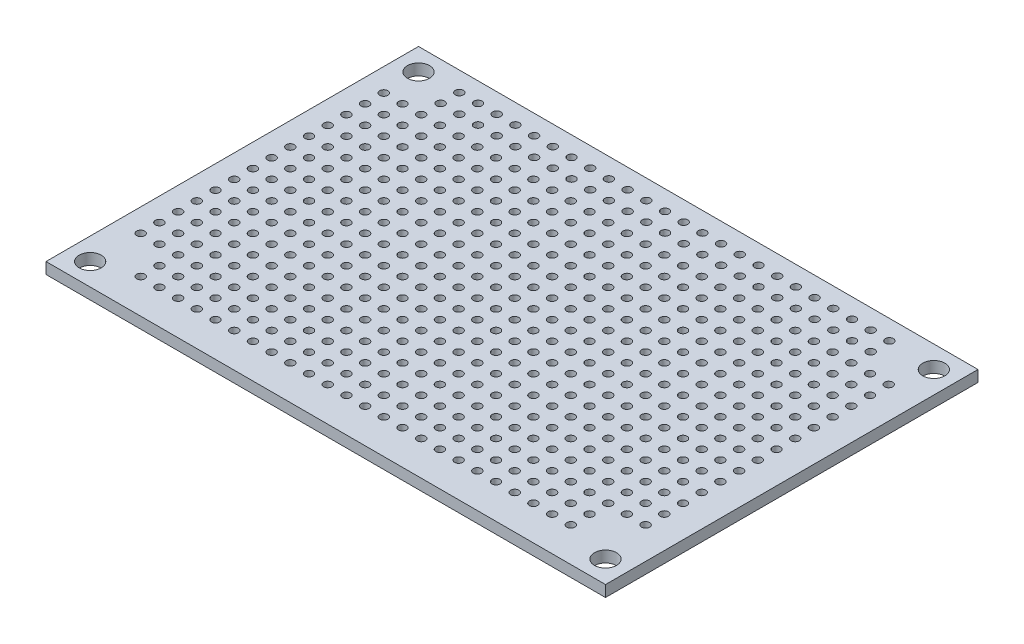
from build123d import *

# Parameters (mm, degrees)
SKETCH1_W           = 76
SKETCH1_H           = 50.6
SKETCH1_R           = 1.5
BOSS_EXTRUDE1_DEPTH = 1.53
SKETCH2_R           = 0.55
CUT_EXTRUDE1_DEPTH  = 46.677465998


with BuildPart() as part:
    # Sketch1 → Boss-Extrude1 (new body)
    with BuildSketch(Plane(origin=(0, 0, 0), x_dir=(1, 0, 0), z_dir=(0, 1, 0))):
        Rectangle(SKETCH1_W, SKETCH1_H)
        with Locations(Location((35, 22.3, 0), (0, 0, 270))):
            Circle(SKETCH1_R, mode=Mode.SUBTRACT)
        with Locations(Location((35, -22.3, 0), (0, 0, 270))):
            Circle(SKETCH1_R, mode=Mode.SUBTRACT)
        with Locations(Location((-35, -22.3, 0), (0, 0, 270))):
            Circle(SKETCH1_R, mode=Mode.SUBTRACT)
        with Locations(Location((-35, 22.3, 0), (0, 0, 270))):
            Circle(SKETCH1_R, mode=Mode.SUBTRACT)
    extrude(amount=BOSS_EXTRUDE1_DEPTH)

    # Sketch2 → Cut-Extrude1 (cut, through all)
    with BuildSketch(Plane(origin=(0, 1.53, 0), x_dir=(1, 0, 0), z_dir=(0, 1, 0))):
        with Locations(Location((-34.879245088, 17.46658145, 0), (0, 0, 270))):
            Circle(SKETCH2_R)
        with Locations(Location((-32.339245088, 17.46658145, 0), (0, 0, 270))):
            Circle(SKETCH2_R)
        with Locations(Location((-29.799245088, 17.46658145, 0), (0, 0, 270))):
            Circle(SKETCH2_R)
        with Locations(Location((-27.259245088, 17.46658145, 0), (0, 0, 270))):
            Circle(SKETCH2_R)
        with Locations(Location((-24.719245088, 17.46658145, 0), (0, 0, 270))):
            Circle(SKETCH2_R)
        with Locations(Location((-22.179245088, 17.46658145, 0), (0, 0, 270))):
            Circle(SKETCH2_R)
        with Locations(Location((-19.639245088, 17.46658145, 0), (0, 0, 270))):
            Circle(SKETCH2_R)
        with Locations(Location((-17.099245088, 17.46658145, 0), (0, 0, 270))):
            Circle(SKETCH2_R)
        with Locations(Location((-14.559245088, 17.46658145, 0), (0, 0, 270))):
            Circle(SKETCH2_R)
        with Locations(Location((-12.019245088, 17.46658145, 0), (0, 0, 270))):
            Circle(SKETCH2_R)
        with Locations(Location((-9.479245088, 17.46658145, 0), (0, 0, 270))):
            Circle(SKETCH2_R)
        with Locations(Location((-6.939245088, 17.46658145, 0), (0, 0, 270))):
            Circle(SKETCH2_R)
        with Locations(Location((-4.399245088, 17.46658145, 0), (0, 0, 270))):
            Circle(SKETCH2_R)
        with Locations(Location((-1.859245088, 17.46658145, 0), (0, 0, 270))):
            Circle(SKETCH2_R)
        with Locations(Location((0.680754912, 17.46658145, 0), (0, 0, 270))):
            Circle(SKETCH2_R)
        with Locations(Location((3.220754912, 17.46658145, 0), (0, 0, 270))):
            Circle(SKETCH2_R)
        with Locations(Location((5.760754912, 17.46658145, 0), (0, 0, 270))):
            Circle(SKETCH2_R)
        with Locations(Location((8.300754912, 17.46658145, 0), (0, 0, 270))):
            Circle(SKETCH2_R)
        with Locations(Location((10.840754912, 17.46658145, 0), (0, 0, 270))):
            Circle(SKETCH2_R)
        with Locations(Location((13.380754912, 17.46658145, 0), (0, 0, 270))):
            Circle(SKETCH2_R)
        with Locations(Location((15.920754912, 17.46658145, 0), (0, 0, 270))):
            Circle(SKETCH2_R)
        with Locations(Location((18.460754912, 17.46658145, 0), (0, 0, 270))):
            Circle(SKETCH2_R)
        with Locations(Location((21.000754912, 17.46658145, 0), (0, 0, 270))):
            Circle(SKETCH2_R)
        with Locations(Location((23.540754912, 17.46658145, 0), (0, 0, 270))):
            Circle(SKETCH2_R)
        with Locations(Location((26.080754912, 17.46658145, 0), (0, 0, 270))):
            Circle(SKETCH2_R)
        with Locations(Location((28.620754912, 17.46658145, 0), (0, 0, 270))):
            Circle(SKETCH2_R)
        with Locations(Location((31.160754912, 17.46658145, 0), (0, 0, 270))):
            Circle(SKETCH2_R)
        with Locations(Location((33.700754912, 17.46658145, 0), (0, 0, 270))):
            Circle(SKETCH2_R)
        with Locations(Location((-32.339245088, 14.92658145, 0), (0, 0, 270))):
            Circle(SKETCH2_R)
        with Locations(Location((-29.799245088, 14.92658145, 0), (0, 0, 270))):
            Circle(SKETCH2_R)
        with Locations(Location((-27.259245088, 14.92658145, 0), (0, 0, 270))):
            Circle(SKETCH2_R)
        with Locations(Location((-24.719245088, 14.92658145, 0), (0, 0, 270))):
            Circle(SKETCH2_R)
        with Locations(Location((-22.179245088, 14.92658145, 0), (0, 0, 270))):
            Circle(SKETCH2_R)
        with Locations(Location((-19.639245088, 14.92658145, 0), (0, 0, 270))):
            Circle(SKETCH2_R)
        with Locations(Location((-17.099245088, 14.92658145, 0), (0, 0, 270))):
            Circle(SKETCH2_R)
        with Locations(Location((-14.559245088, 14.92658145, 0), (0, 0, 270))):
            Circle(SKETCH2_R)
        with Locations(Location((-12.019245088, 14.92658145, 0), (0, 0, 270))):
            Circle(SKETCH2_R)
        with Locations(Location((-9.479245088, 14.92658145, 0), (0, 0, 270))):
            Circle(SKETCH2_R)
        with Locations(Location((-6.939245088, 14.92658145, 0), (0, 0, 270))):
            Circle(SKETCH2_R)
        with Locations(Location((-4.399245088, 14.92658145, 0), (0, 0, 270))):
            Circle(SKETCH2_R)
        with Locations(Location((-1.859245088, 14.92658145, 0), (0, 0, 270))):
            Circle(SKETCH2_R)
        with Locations(Location((0.680754912, 14.92658145, 0), (0, 0, 270))):
            Circle(SKETCH2_R)
        with Locations(Location((3.220754912, 14.92658145, 0), (0, 0, 270))):
            Circle(SKETCH2_R)
        with Locations(Location((5.760754912, 14.92658145, 0), (0, 0, 270))):
            Circle(SKETCH2_R)
        with Locations(Location((8.300754912, 14.92658145, 0), (0, 0, 270))):
            Circle(SKETCH2_R)
        with Locations(Location((10.840754912, 14.92658145, 0), (0, 0, 270))):
            Circle(SKETCH2_R)
        with Locations(Location((13.380754912, 14.92658145, 0), (0, 0, 270))):
            Circle(SKETCH2_R)
        with Locations(Location((15.920754912, 14.92658145, 0), (0, 0, 270))):
            Circle(SKETCH2_R)
        with Locations(Location((18.460754912, 14.92658145, 0), (0, 0, 270))):
            Circle(SKETCH2_R)
        with Locations(Location((21.000754912, 14.92658145, 0), (0, 0, 270))):
            Circle(SKETCH2_R)
        with Locations(Location((23.540754912, 14.92658145, 0), (0, 0, 270))):
            Circle(SKETCH2_R)
        with Locations(Location((26.080754912, 14.92658145, 0), (0, 0, 270))):
            Circle(SKETCH2_R)
        with Locations(Location((28.620754912, 14.92658145, 0), (0, 0, 270))):
            Circle(SKETCH2_R)
        with Locations(Location((31.160754912, 14.92658145, 0), (0, 0, 270))):
            Circle(SKETCH2_R)
        with Locations(Location((33.700754912, 14.92658145, 0), (0, 0, 270))):
            Circle(SKETCH2_R)
        with Locations(Location((-32.339245088, 12.38658145, 0), (0, 0, 270))):
            Circle(SKETCH2_R)
        with Locations(Location((-29.799245088, 12.38658145, 0), (0, 0, 270))):
            Circle(SKETCH2_R)
        with Locations(Location((-27.259245088, 12.38658145, 0), (0, 0, 270))):
            Circle(SKETCH2_R)
        with Locations(Location((-24.719245088, 12.38658145, 0), (0, 0, 270))):
            Circle(SKETCH2_R)
        with Locations(Location((-22.179245088, 12.38658145, 0), (0, 0, 270))):
            Circle(SKETCH2_R)
        with Locations(Location((-19.639245088, 12.38658145, 0), (0, 0, 270))):
            Circle(SKETCH2_R)
        with Locations(Location((-17.099245088, 12.38658145, 0), (0, 0, 270))):
            Circle(SKETCH2_R)
        with Locations(Location((-14.559245088, 12.38658145, 0), (0, 0, 270))):
            Circle(SKETCH2_R)
        with Locations(Location((-12.019245088, 12.38658145, 0), (0, 0, 270))):
            Circle(SKETCH2_R)
        with Locations(Location((-9.479245088, 12.38658145, 0), (0, 0, 270))):
            Circle(SKETCH2_R)
        with Locations(Location((-6.939245088, 12.38658145, 0), (0, 0, 270))):
            Circle(SKETCH2_R)
        with Locations(Location((-4.399245088, 12.38658145, 0), (0, 0, 270))):
            Circle(SKETCH2_R)
        with Locations(Location((-1.859245088, 12.38658145, 0), (0, 0, 270))):
            Circle(SKETCH2_R)
        with Locations(Location((0.680754912, 12.38658145, 0), (0, 0, 270))):
            Circle(SKETCH2_R)
        with Locations(Location((3.220754912, 12.38658145, 0), (0, 0, 270))):
            Circle(SKETCH2_R)
        with Locations(Location((5.760754912, 12.38658145, 0), (0, 0, 270))):
            Circle(SKETCH2_R)
        with Locations(Location((8.300754912, 12.38658145, 0), (0, 0, 270))):
            Circle(SKETCH2_R)
        with Locations(Location((10.840754912, 12.38658145, 0), (0, 0, 270))):
            Circle(SKETCH2_R)
        with Locations(Location((13.380754912, 12.38658145, 0), (0, 0, 270))):
            Circle(SKETCH2_R)
        with Locations(Location((15.920754912, 12.38658145, 0), (0, 0, 270))):
            Circle(SKETCH2_R)
        with Locations(Location((18.460754912, 12.38658145, 0), (0, 0, 270))):
            Circle(SKETCH2_R)
        with Locations(Location((21.000754912, 12.38658145, 0), (0, 0, 270))):
            Circle(SKETCH2_R)
        with Locations(Location((23.540754912, 12.38658145, 0), (0, 0, 270))):
            Circle(SKETCH2_R)
        with Locations(Location((26.080754912, 12.38658145, 0), (0, 0, 270))):
            Circle(SKETCH2_R)
        with Locations(Location((28.620754912, 12.38658145, 0), (0, 0, 270))):
            Circle(SKETCH2_R)
        with Locations(Location((31.160754912, 12.38658145, 0), (0, 0, 270))):
            Circle(SKETCH2_R)
        with Locations(Location((33.700754912, 12.38658145, 0), (0, 0, 270))):
            Circle(SKETCH2_R)
        with Locations(Location((-32.339245088, 9.84658145, 0), (0, 0, 270))):
            Circle(SKETCH2_R)
        with Locations(Location((-29.799245088, 9.84658145, 0), (0, 0, 270))):
            Circle(SKETCH2_R)
        with Locations(Location((-27.259245088, 9.84658145, 0), (0, 0, 270))):
            Circle(SKETCH2_R)
        with Locations(Location((-24.719245088, 9.84658145, 0), (0, 0, 270))):
            Circle(SKETCH2_R)
        with Locations(Location((-22.179245088, 9.84658145, 0), (0, 0, 270))):
            Circle(SKETCH2_R)
        with Locations(Location((-19.639245088, 9.84658145, 0), (0, 0, 270))):
            Circle(SKETCH2_R)
        with Locations(Location((-17.099245088, 9.84658145, 0), (0, 0, 270))):
            Circle(SKETCH2_R)
        with Locations(Location((-14.559245088, 9.84658145, 0), (0, 0, 270))):
            Circle(SKETCH2_R)
        with Locations(Location((-12.019245088, 9.84658145, 0), (0, 0, 270))):
            Circle(SKETCH2_R)
        with Locations(Location((-9.479245088, 9.84658145, 0), (0, 0, 270))):
            Circle(SKETCH2_R)
        with Locations(Location((-6.939245088, 9.84658145, 0), (0, 0, 270))):
            Circle(SKETCH2_R)
        with Locations(Location((-4.399245088, 9.84658145, 0), (0, 0, 270))):
            Circle(SKETCH2_R)
        with Locations(Location((-1.859245088, 9.84658145, 0), (0, 0, 270))):
            Circle(SKETCH2_R)
        with Locations(Location((0.680754912, 9.84658145, 0), (0, 0, 270))):
            Circle(SKETCH2_R)
        with Locations(Location((3.220754912, 9.84658145, 0), (0, 0, 270))):
            Circle(SKETCH2_R)
        with Locations(Location((5.760754912, 9.84658145, 0), (0, 0, 270))):
            Circle(SKETCH2_R)
        with Locations(Location((8.300754912, 9.84658145, 0), (0, 0, 270))):
            Circle(SKETCH2_R)
        with Locations(Location((10.840754912, 9.84658145, 0), (0, 0, 270))):
            Circle(SKETCH2_R)
        with Locations(Location((13.380754912, 9.84658145, 0), (0, 0, 270))):
            Circle(SKETCH2_R)
        with Locations(Location((15.920754912, 9.84658145, 0), (0, 0, 270))):
            Circle(SKETCH2_R)
        with Locations(Location((18.460754912, 9.84658145, 0), (0, 0, 270))):
            Circle(SKETCH2_R)
        with Locations(Location((21.000754912, 9.84658145, 0), (0, 0, 270))):
            Circle(SKETCH2_R)
        with Locations(Location((23.540754912, 9.84658145, 0), (0, 0, 270))):
            Circle(SKETCH2_R)
        with Locations(Location((26.080754912, 9.84658145, 0), (0, 0, 270))):
            Circle(SKETCH2_R)
        with Locations(Location((28.620754912, 9.84658145, 0), (0, 0, 270))):
            Circle(SKETCH2_R)
        with Locations(Location((31.160754912, 9.84658145, 0), (0, 0, 270))):
            Circle(SKETCH2_R)
        with Locations(Location((33.700754912, 9.84658145, 0), (0, 0, 270))):
            Circle(SKETCH2_R)
        with Locations(Location((-32.339245088, 7.30658145, 0), (0, 0, 270))):
            Circle(SKETCH2_R)
        with Locations(Location((-29.799245088, 7.30658145, 0), (0, 0, 270))):
            Circle(SKETCH2_R)
        with Locations(Location((-27.259245088, 7.30658145, 0), (0, 0, 270))):
            Circle(SKETCH2_R)
        with Locations(Location((-24.719245088, 7.30658145, 0), (0, 0, 270))):
            Circle(SKETCH2_R)
        with Locations(Location((-22.179245088, 7.30658145, 0), (0, 0, 270))):
            Circle(SKETCH2_R)
        with Locations(Location((-19.639245088, 7.30658145, 0), (0, 0, 270))):
            Circle(SKETCH2_R)
        with Locations(Location((-17.099245088, 7.30658145, 0), (0, 0, 270))):
            Circle(SKETCH2_R)
        with Locations(Location((-14.559245088, 7.30658145, 0), (0, 0, 270))):
            Circle(SKETCH2_R)
        with Locations(Location((-12.019245088, 7.30658145, 0), (0, 0, 270))):
            Circle(SKETCH2_R)
        with Locations(Location((-9.479245088, 7.30658145, 0), (0, 0, 270))):
            Circle(SKETCH2_R)
        with Locations(Location((-6.939245088, 7.30658145, 0), (0, 0, 270))):
            Circle(SKETCH2_R)
        with Locations(Location((-4.399245088, 7.30658145, 0), (0, 0, 270))):
            Circle(SKETCH2_R)
        with Locations(Location((-1.859245088, 7.30658145, 0), (0, 0, 270))):
            Circle(SKETCH2_R)
        with Locations(Location((0.680754912, 7.30658145, 0), (0, 0, 270))):
            Circle(SKETCH2_R)
        with Locations(Location((3.220754912, 7.30658145, 0), (0, 0, 270))):
            Circle(SKETCH2_R)
        with Locations(Location((5.760754912, 7.30658145, 0), (0, 0, 270))):
            Circle(SKETCH2_R)
        with Locations(Location((8.300754912, 7.30658145, 0), (0, 0, 270))):
            Circle(SKETCH2_R)
        with Locations(Location((10.840754912, 7.30658145, 0), (0, 0, 270))):
            Circle(SKETCH2_R)
        with Locations(Location((13.380754912, 7.30658145, 0), (0, 0, 270))):
            Circle(SKETCH2_R)
        with Locations(Location((15.920754912, 7.30658145, 0), (0, 0, 270))):
            Circle(SKETCH2_R)
        with Locations(Location((18.460754912, 7.30658145, 0), (0, 0, 270))):
            Circle(SKETCH2_R)
        with Locations(Location((21.000754912, 7.30658145, 0), (0, 0, 270))):
            Circle(SKETCH2_R)
        with Locations(Location((23.540754912, 7.30658145, 0), (0, 0, 270))):
            Circle(SKETCH2_R)
        with Locations(Location((26.080754912, 7.30658145, 0), (0, 0, 270))):
            Circle(SKETCH2_R)
        with Locations(Location((28.620754912, 7.30658145, 0), (0, 0, 270))):
            Circle(SKETCH2_R)
        with Locations(Location((31.160754912, 7.30658145, 0), (0, 0, 270))):
            Circle(SKETCH2_R)
        with Locations(Location((33.700754912, 7.30658145, 0), (0, 0, 270))):
            Circle(SKETCH2_R)
        with Locations(Location((-32.339245088, 4.76658145, 0), (0, 0, 270))):
            Circle(SKETCH2_R)
        with Locations(Location((-29.799245088, 4.76658145, 0), (0, 0, 270))):
            Circle(SKETCH2_R)
        with Locations(Location((-27.259245088, 4.76658145, 0), (0, 0, 270))):
            Circle(SKETCH2_R)
        with Locations(Location((-24.719245088, 4.76658145, 0), (0, 0, 270))):
            Circle(SKETCH2_R)
        with Locations(Location((-22.179245088, 4.76658145, 0), (0, 0, 270))):
            Circle(SKETCH2_R)
        with Locations(Location((-19.639245088, 4.76658145, 0), (0, 0, 270))):
            Circle(SKETCH2_R)
        with Locations(Location((-17.099245088, 4.76658145, 0), (0, 0, 270))):
            Circle(SKETCH2_R)
        with Locations(Location((-14.559245088, 4.76658145, 0), (0, 0, 270))):
            Circle(SKETCH2_R)
        with Locations(Location((-12.019245088, 4.76658145, 0), (0, 0, 270))):
            Circle(SKETCH2_R)
        with Locations(Location((-9.479245088, 4.76658145, 0), (0, 0, 270))):
            Circle(SKETCH2_R)
        with Locations(Location((-6.939245088, 4.76658145, 0), (0, 0, 270))):
            Circle(SKETCH2_R)
        with Locations(Location((-4.399245088, 4.76658145, 0), (0, 0, 270))):
            Circle(SKETCH2_R)
        with Locations(Location((-1.859245088, 4.76658145, 0), (0, 0, 270))):
            Circle(SKETCH2_R)
        with Locations(Location((0.680754912, 4.76658145, 0), (0, 0, 270))):
            Circle(SKETCH2_R)
        with Locations(Location((3.220754912, 4.76658145, 0), (0, 0, 270))):
            Circle(SKETCH2_R)
        with Locations(Location((5.760754912, 4.76658145, 0), (0, 0, 270))):
            Circle(SKETCH2_R)
        with Locations(Location((8.300754912, 4.76658145, 0), (0, 0, 270))):
            Circle(SKETCH2_R)
        with Locations(Location((10.840754912, 4.76658145, 0), (0, 0, 270))):
            Circle(SKETCH2_R)
        with Locations(Location((13.380754912, 4.76658145, 0), (0, 0, 270))):
            Circle(SKETCH2_R)
        with Locations(Location((15.920754912, 4.76658145, 0), (0, 0, 270))):
            Circle(SKETCH2_R)
        with Locations(Location((18.460754912, 4.76658145, 0), (0, 0, 270))):
            Circle(SKETCH2_R)
        with Locations(Location((21.000754912, 4.76658145, 0), (0, 0, 270))):
            Circle(SKETCH2_R)
        with Locations(Location((23.540754912, 4.76658145, 0), (0, 0, 270))):
            Circle(SKETCH2_R)
        with Locations(Location((26.080754912, 4.76658145, 0), (0, 0, 270))):
            Circle(SKETCH2_R)
        with Locations(Location((28.620754912, 4.76658145, 0), (0, 0, 270))):
            Circle(SKETCH2_R)
        with Locations(Location((31.160754912, 4.76658145, 0), (0, 0, 270))):
            Circle(SKETCH2_R)
        with Locations(Location((33.700754912, 4.76658145, 0), (0, 0, 270))):
            Circle(SKETCH2_R)
        with Locations(Location((-32.339245088, 2.22658145, 0), (0, 0, 270))):
            Circle(SKETCH2_R)
        with Locations(Location((-29.799245088, 2.22658145, 0), (0, 0, 270))):
            Circle(SKETCH2_R)
        with Locations(Location((-27.259245088, 2.22658145, 0), (0, 0, 270))):
            Circle(SKETCH2_R)
        with Locations(Location((-24.719245088, 2.22658145, 0), (0, 0, 270))):
            Circle(SKETCH2_R)
        with Locations(Location((-22.179245088, 2.22658145, 0), (0, 0, 270))):
            Circle(SKETCH2_R)
        with Locations(Location((-19.639245088, 2.22658145, 0), (0, 0, 270))):
            Circle(SKETCH2_R)
        with Locations(Location((-17.099245088, 2.22658145, 0), (0, 0, 270))):
            Circle(SKETCH2_R)
        with Locations(Location((-14.559245088, 2.22658145, 0), (0, 0, 270))):
            Circle(SKETCH2_R)
        with Locations(Location((-12.019245088, 2.22658145, 0), (0, 0, 270))):
            Circle(SKETCH2_R)
        with Locations(Location((-9.479245088, 2.22658145, 0), (0, 0, 270))):
            Circle(SKETCH2_R)
        with Locations(Location((-6.939245088, 2.22658145, 0), (0, 0, 270))):
            Circle(SKETCH2_R)
        with Locations(Location((-4.399245088, 2.22658145, 0), (0, 0, 270))):
            Circle(SKETCH2_R)
        with Locations(Location((-1.859245088, 2.22658145, 0), (0, 0, 270))):
            Circle(SKETCH2_R)
        with Locations(Location((0.680754912, 2.22658145, 0), (0, 0, 270))):
            Circle(SKETCH2_R)
        with Locations(Location((3.220754912, 2.22658145, 0), (0, 0, 270))):
            Circle(SKETCH2_R)
        with Locations(Location((5.760754912, 2.22658145, 0), (0, 0, 270))):
            Circle(SKETCH2_R)
        with Locations(Location((8.300754912, 2.22658145, 0), (0, 0, 270))):
            Circle(SKETCH2_R)
        with Locations(Location((10.840754912, 2.22658145, 0), (0, 0, 270))):
            Circle(SKETCH2_R)
        with Locations(Location((13.380754912, 2.22658145, 0), (0, 0, 270))):
            Circle(SKETCH2_R)
        with Locations(Location((15.920754912, 2.22658145, 0), (0, 0, 270))):
            Circle(SKETCH2_R)
        with Locations(Location((18.460754912, 2.22658145, 0), (0, 0, 270))):
            Circle(SKETCH2_R)
        with Locations(Location((21.000754912, 2.22658145, 0), (0, 0, 270))):
            Circle(SKETCH2_R)
        with Locations(Location((23.540754912, 2.22658145, 0), (0, 0, 270))):
            Circle(SKETCH2_R)
        with Locations(Location((26.080754912, 2.22658145, 0), (0, 0, 270))):
            Circle(SKETCH2_R)
        with Locations(Location((28.620754912, 2.22658145, 0), (0, 0, 270))):
            Circle(SKETCH2_R)
        with Locations(Location((31.160754912, 2.22658145, 0), (0, 0, 270))):
            Circle(SKETCH2_R)
        with Locations(Location((33.700754912, 2.22658145, 0), (0, 0, 270))):
            Circle(SKETCH2_R)
        with Locations(Location((-32.339245088, -0.31341855, 0), (0, 0, 270))):
            Circle(SKETCH2_R)
        with Locations(Location((-29.799245088, -0.31341855, 0), (0, 0, 270))):
            Circle(SKETCH2_R)
        with Locations(Location((-27.259245088, -0.31341855, 0), (0, 0, 270))):
            Circle(SKETCH2_R)
        with Locations(Location((-24.719245088, -0.31341855, 0), (0, 0, 270))):
            Circle(SKETCH2_R)
        with Locations(Location((-22.179245088, -0.31341855, 0), (0, 0, 270))):
            Circle(SKETCH2_R)
        with Locations(Location((-19.639245088, -0.31341855, 0), (0, 0, 270))):
            Circle(SKETCH2_R)
        with Locations(Location((-17.099245088, -0.31341855, 0), (0, 0, 270))):
            Circle(SKETCH2_R)
        with Locations(Location((-14.559245088, -0.31341855, 0), (0, 0, 270))):
            Circle(SKETCH2_R)
        with Locations(Location((-12.019245088, -0.31341855, 0), (0, 0, 270))):
            Circle(SKETCH2_R)
        with Locations(Location((-9.479245088, -0.31341855, 0), (0, 0, 270))):
            Circle(SKETCH2_R)
        with Locations(Location((-6.939245088, -0.31341855, 0), (0, 0, 270))):
            Circle(SKETCH2_R)
        with Locations(Location((-4.399245088, -0.31341855, 0), (0, 0, 270))):
            Circle(SKETCH2_R)
        with Locations(Location((-1.859245088, -0.31341855, 0), (0, 0, 270))):
            Circle(SKETCH2_R)
        with Locations(Location((0.680754912, -0.31341855, 0), (0, 0, 270))):
            Circle(SKETCH2_R)
        with Locations(Location((3.220754912, -0.31341855, 0), (0, 0, 270))):
            Circle(SKETCH2_R)
        with Locations(Location((5.760754912, -0.31341855, 0), (0, 0, 270))):
            Circle(SKETCH2_R)
        with Locations(Location((8.300754912, -0.31341855, 0), (0, 0, 270))):
            Circle(SKETCH2_R)
        with Locations(Location((10.840754912, -0.31341855, 0), (0, 0, 270))):
            Circle(SKETCH2_R)
        with Locations(Location((13.380754912, -0.31341855, 0), (0, 0, 270))):
            Circle(SKETCH2_R)
        with Locations(Location((15.920754912, -0.31341855, 0), (0, 0, 270))):
            Circle(SKETCH2_R)
        with Locations(Location((18.460754912, -0.31341855, 0), (0, 0, 270))):
            Circle(SKETCH2_R)
        with Locations(Location((21.000754912, -0.31341855, 0), (0, 0, 270))):
            Circle(SKETCH2_R)
        with Locations(Location((23.540754912, -0.31341855, 0), (0, 0, 270))):
            Circle(SKETCH2_R)
        with Locations(Location((26.080754912, -0.31341855, 0), (0, 0, 270))):
            Circle(SKETCH2_R)
        with Locations(Location((28.620754912, -0.31341855, 0), (0, 0, 270))):
            Circle(SKETCH2_R)
        with Locations(Location((31.160754912, -0.31341855, 0), (0, 0, 270))):
            Circle(SKETCH2_R)
        with Locations(Location((33.700754912, -0.31341855, 0), (0, 0, 270))):
            Circle(SKETCH2_R)
        with Locations(Location((-32.339245088, -2.85341855, 0), (0, 0, 270))):
            Circle(SKETCH2_R)
        with Locations(Location((-29.799245088, -2.85341855, 0), (0, 0, 270))):
            Circle(SKETCH2_R)
        with Locations(Location((-27.259245088, -2.85341855, 0), (0, 0, 270))):
            Circle(SKETCH2_R)
        with Locations(Location((-24.719245088, -2.85341855, 0), (0, 0, 270))):
            Circle(SKETCH2_R)
        with Locations(Location((-22.179245088, -2.85341855, 0), (0, 0, 270))):
            Circle(SKETCH2_R)
        with Locations(Location((-19.639245088, -2.85341855, 0), (0, 0, 270))):
            Circle(SKETCH2_R)
        with Locations(Location((-17.099245088, -2.85341855, 0), (0, 0, 270))):
            Circle(SKETCH2_R)
        with Locations(Location((-14.559245088, -2.85341855, 0), (0, 0, 270))):
            Circle(SKETCH2_R)
        with Locations(Location((-12.019245088, -2.85341855, 0), (0, 0, 270))):
            Circle(SKETCH2_R)
        with Locations(Location((-9.479245088, -2.85341855, 0), (0, 0, 270))):
            Circle(SKETCH2_R)
        with Locations(Location((-6.939245088, -2.85341855, 0), (0, 0, 270))):
            Circle(SKETCH2_R)
        with Locations(Location((-4.399245088, -2.85341855, 0), (0, 0, 270))):
            Circle(SKETCH2_R)
        with Locations(Location((-1.859245088, -2.85341855, 0), (0, 0, 270))):
            Circle(SKETCH2_R)
        with Locations(Location((0.680754912, -2.85341855, 0), (0, 0, 270))):
            Circle(SKETCH2_R)
        with Locations(Location((3.220754912, -2.85341855, 0), (0, 0, 270))):
            Circle(SKETCH2_R)
        with Locations(Location((5.760754912, -2.85341855, 0), (0, 0, 270))):
            Circle(SKETCH2_R)
        with Locations(Location((8.300754912, -2.85341855, 0), (0, 0, 270))):
            Circle(SKETCH2_R)
        with Locations(Location((10.840754912, -2.85341855, 0), (0, 0, 270))):
            Circle(SKETCH2_R)
        with Locations(Location((13.380754912, -2.85341855, 0), (0, 0, 270))):
            Circle(SKETCH2_R)
        with Locations(Location((15.920754912, -2.85341855, 0), (0, 0, 270))):
            Circle(SKETCH2_R)
        with Locations(Location((18.460754912, -2.85341855, 0), (0, 0, 270))):
            Circle(SKETCH2_R)
        with Locations(Location((21.000754912, -2.85341855, 0), (0, 0, 270))):
            Circle(SKETCH2_R)
        with Locations(Location((23.540754912, -2.85341855, 0), (0, 0, 270))):
            Circle(SKETCH2_R)
        with Locations(Location((26.080754912, -2.85341855, 0), (0, 0, 270))):
            Circle(SKETCH2_R)
        with Locations(Location((28.620754912, -2.85341855, 0), (0, 0, 270))):
            Circle(SKETCH2_R)
        with Locations(Location((31.160754912, -2.85341855, 0), (0, 0, 270))):
            Circle(SKETCH2_R)
        with Locations(Location((33.700754912, -2.85341855, 0), (0, 0, 270))):
            Circle(SKETCH2_R)
        with Locations(Location((-32.339245088, -5.39341855, 0), (0, 0, 270))):
            Circle(SKETCH2_R)
        with Locations(Location((-29.799245088, -5.39341855, 0), (0, 0, 270))):
            Circle(SKETCH2_R)
        with Locations(Location((-27.259245088, -5.39341855, 0), (0, 0, 270))):
            Circle(SKETCH2_R)
        with Locations(Location((-24.719245088, -5.39341855, 0), (0, 0, 270))):
            Circle(SKETCH2_R)
        with Locations(Location((-22.179245088, -5.39341855, 0), (0, 0, 270))):
            Circle(SKETCH2_R)
        with Locations(Location((-19.639245088, -5.39341855, 0), (0, 0, 270))):
            Circle(SKETCH2_R)
        with Locations(Location((-17.099245088, -5.39341855, 0), (0, 0, 270))):
            Circle(SKETCH2_R)
        with Locations(Location((-14.559245088, -5.39341855, 0), (0, 0, 270))):
            Circle(SKETCH2_R)
        with Locations(Location((-12.019245088, -5.39341855, 0), (0, 0, 270))):
            Circle(SKETCH2_R)
        with Locations(Location((-9.479245088, -5.39341855, 0), (0, 0, 270))):
            Circle(SKETCH2_R)
        with Locations(Location((-6.939245088, -5.39341855, 0), (0, 0, 270))):
            Circle(SKETCH2_R)
        with Locations(Location((-4.399245088, -5.39341855, 0), (0, 0, 270))):
            Circle(SKETCH2_R)
        with Locations(Location((-1.859245088, -5.39341855, 0), (0, 0, 270))):
            Circle(SKETCH2_R)
        with Locations(Location((0.680754912, -5.39341855, 0), (0, 0, 270))):
            Circle(SKETCH2_R)
        with Locations(Location((3.220754912, -5.39341855, 0), (0, 0, 270))):
            Circle(SKETCH2_R)
        with Locations(Location((5.760754912, -5.39341855, 0), (0, 0, 270))):
            Circle(SKETCH2_R)
        with Locations(Location((8.300754912, -5.39341855, 0), (0, 0, 270))):
            Circle(SKETCH2_R)
        with Locations(Location((10.840754912, -5.39341855, 0), (0, 0, 270))):
            Circle(SKETCH2_R)
        with Locations(Location((13.380754912, -5.39341855, 0), (0, 0, 270))):
            Circle(SKETCH2_R)
        with Locations(Location((15.920754912, -5.39341855, 0), (0, 0, 270))):
            Circle(SKETCH2_R)
        with Locations(Location((18.460754912, -5.39341855, 0), (0, 0, 270))):
            Circle(SKETCH2_R)
        with Locations(Location((21.000754912, -5.39341855, 0), (0, 0, 270))):
            Circle(SKETCH2_R)
        with Locations(Location((23.540754912, -5.39341855, 0), (0, 0, 270))):
            Circle(SKETCH2_R)
        with Locations(Location((26.080754912, -5.39341855, 0), (0, 0, 270))):
            Circle(SKETCH2_R)
        with Locations(Location((28.620754912, -5.39341855, 0), (0, 0, 270))):
            Circle(SKETCH2_R)
        with Locations(Location((31.160754912, -5.39341855, 0), (0, 0, 270))):
            Circle(SKETCH2_R)
        with Locations(Location((33.700754912, -5.39341855, 0), (0, 0, 270))):
            Circle(SKETCH2_R)
        with Locations(Location((-32.339245088, -7.93341855, 0), (0, 0, 270))):
            Circle(SKETCH2_R)
        with Locations(Location((-29.799245088, -7.93341855, 0), (0, 0, 270))):
            Circle(SKETCH2_R)
        with Locations(Location((-27.259245088, -7.93341855, 0), (0, 0, 270))):
            Circle(SKETCH2_R)
        with Locations(Location((-24.719245088, -7.93341855, 0), (0, 0, 270))):
            Circle(SKETCH2_R)
        with Locations(Location((-22.179245088, -7.93341855, 0), (0, 0, 270))):
            Circle(SKETCH2_R)
        with Locations(Location((-19.639245088, -7.93341855, 0), (0, 0, 270))):
            Circle(SKETCH2_R)
        with Locations(Location((-17.099245088, -7.93341855, 0), (0, 0, 270))):
            Circle(SKETCH2_R)
        with Locations(Location((-14.559245088, -7.93341855, 0), (0, 0, 270))):
            Circle(SKETCH2_R)
        with Locations(Location((-12.019245088, -7.93341855, 0), (0, 0, 270))):
            Circle(SKETCH2_R)
        with Locations(Location((-9.479245088, -7.93341855, 0), (0, 0, 270))):
            Circle(SKETCH2_R)
        with Locations(Location((-6.939245088, -7.93341855, 0), (0, 0, 270))):
            Circle(SKETCH2_R)
        with Locations(Location((-4.399245088, -7.93341855, 0), (0, 0, 270))):
            Circle(SKETCH2_R)
        with Locations(Location((-1.859245088, -7.93341855, 0), (0, 0, 270))):
            Circle(SKETCH2_R)
        with Locations(Location((0.680754912, -7.93341855, 0), (0, 0, 270))):
            Circle(SKETCH2_R)
        with Locations(Location((3.220754912, -7.93341855, 0), (0, 0, 270))):
            Circle(SKETCH2_R)
        with Locations(Location((5.760754912, -7.93341855, 0), (0, 0, 270))):
            Circle(SKETCH2_R)
        with Locations(Location((8.300754912, -7.93341855, 0), (0, 0, 270))):
            Circle(SKETCH2_R)
        with Locations(Location((10.840754912, -7.93341855, 0), (0, 0, 270))):
            Circle(SKETCH2_R)
        with Locations(Location((13.380754912, -7.93341855, 0), (0, 0, 270))):
            Circle(SKETCH2_R)
        with Locations(Location((15.920754912, -7.93341855, 0), (0, 0, 270))):
            Circle(SKETCH2_R)
        with Locations(Location((18.460754912, -7.93341855, 0), (0, 0, 270))):
            Circle(SKETCH2_R)
        with Locations(Location((21.000754912, -7.93341855, 0), (0, 0, 270))):
            Circle(SKETCH2_R)
        with Locations(Location((23.540754912, -7.93341855, 0), (0, 0, 270))):
            Circle(SKETCH2_R)
        with Locations(Location((26.080754912, -7.93341855, 0), (0, 0, 270))):
            Circle(SKETCH2_R)
        with Locations(Location((28.620754912, -7.93341855, 0), (0, 0, 270))):
            Circle(SKETCH2_R)
        with Locations(Location((31.160754912, -7.93341855, 0), (0, 0, 270))):
            Circle(SKETCH2_R)
        with Locations(Location((33.700754912, -7.93341855, 0), (0, 0, 270))):
            Circle(SKETCH2_R)
        with Locations(Location((-32.339245088, -10.47341855, 0), (0, 0, 270))):
            Circle(SKETCH2_R)
        with Locations(Location((-29.799245088, -10.47341855, 0), (0, 0, 270))):
            Circle(SKETCH2_R)
        with Locations(Location((-27.259245088, -10.47341855, 0), (0, 0, 270))):
            Circle(SKETCH2_R)
        with Locations(Location((-24.719245088, -10.47341855, 0), (0, 0, 270))):
            Circle(SKETCH2_R)
        with Locations(Location((-22.179245088, -10.47341855, 0), (0, 0, 270))):
            Circle(SKETCH2_R)
        with Locations(Location((-19.639245088, -10.47341855, 0), (0, 0, 270))):
            Circle(SKETCH2_R)
        with Locations(Location((-17.099245088, -10.47341855, 0), (0, 0, 270))):
            Circle(SKETCH2_R)
        with Locations(Location((-14.559245088, -10.47341855, 0), (0, 0, 270))):
            Circle(SKETCH2_R)
        with Locations(Location((-12.019245088, -10.47341855, 0), (0, 0, 270))):
            Circle(SKETCH2_R)
        with Locations(Location((-9.479245088, -10.47341855, 0), (0, 0, 270))):
            Circle(SKETCH2_R)
        with Locations(Location((-6.939245088, -10.47341855, 0), (0, 0, 270))):
            Circle(SKETCH2_R)
        with Locations(Location((-4.399245088, -10.47341855, 0), (0, 0, 270))):
            Circle(SKETCH2_R)
        with Locations(Location((-1.859245088, -10.47341855, 0), (0, 0, 270))):
            Circle(SKETCH2_R)
        with Locations(Location((0.680754912, -10.47341855, 0), (0, 0, 270))):
            Circle(SKETCH2_R)
        with Locations(Location((3.220754912, -10.47341855, 0), (0, 0, 270))):
            Circle(SKETCH2_R)
        with Locations(Location((5.760754912, -10.47341855, 0), (0, 0, 270))):
            Circle(SKETCH2_R)
        with Locations(Location((8.300754912, -10.47341855, 0), (0, 0, 270))):
            Circle(SKETCH2_R)
        with Locations(Location((10.840754912, -10.47341855, 0), (0, 0, 270))):
            Circle(SKETCH2_R)
        with Locations(Location((13.380754912, -10.47341855, 0), (0, 0, 270))):
            Circle(SKETCH2_R)
        with Locations(Location((15.920754912, -10.47341855, 0), (0, 0, 270))):
            Circle(SKETCH2_R)
        with Locations(Location((18.460754912, -10.47341855, 0), (0, 0, 270))):
            Circle(SKETCH2_R)
        with Locations(Location((21.000754912, -10.47341855, 0), (0, 0, 270))):
            Circle(SKETCH2_R)
        with Locations(Location((23.540754912, -10.47341855, 0), (0, 0, 270))):
            Circle(SKETCH2_R)
        with Locations(Location((26.080754912, -10.47341855, 0), (0, 0, 270))):
            Circle(SKETCH2_R)
        with Locations(Location((28.620754912, -10.47341855, 0), (0, 0, 270))):
            Circle(SKETCH2_R)
        with Locations(Location((31.160754912, -10.47341855, 0), (0, 0, 270))):
            Circle(SKETCH2_R)
        with Locations(Location((33.700754912, -10.47341855, 0), (0, 0, 270))):
            Circle(SKETCH2_R)
        with Locations(Location((-32.339245088, -13.01341855, 0), (0, 0, 270))):
            Circle(SKETCH2_R)
        with Locations(Location((-29.799245088, -13.01341855, 0), (0, 0, 270))):
            Circle(SKETCH2_R)
        with Locations(Location((-27.259245088, -13.01341855, 0), (0, 0, 270))):
            Circle(SKETCH2_R)
        with Locations(Location((-24.719245088, -13.01341855, 0), (0, 0, 270))):
            Circle(SKETCH2_R)
        with Locations(Location((-22.179245088, -13.01341855, 0), (0, 0, 270))):
            Circle(SKETCH2_R)
        with Locations(Location((-19.639245088, -13.01341855, 0), (0, 0, 270))):
            Circle(SKETCH2_R)
        with Locations(Location((-17.099245088, -13.01341855, 0), (0, 0, 270))):
            Circle(SKETCH2_R)
        with Locations(Location((-14.559245088, -13.01341855, 0), (0, 0, 270))):
            Circle(SKETCH2_R)
        with Locations(Location((-12.019245088, -13.01341855, 0), (0, 0, 270))):
            Circle(SKETCH2_R)
        with Locations(Location((-9.479245088, -13.01341855, 0), (0, 0, 270))):
            Circle(SKETCH2_R)
        with Locations(Location((-6.939245088, -13.01341855, 0), (0, 0, 270))):
            Circle(SKETCH2_R)
        with Locations(Location((-4.399245088, -13.01341855, 0), (0, 0, 270))):
            Circle(SKETCH2_R)
        with Locations(Location((-1.859245088, -13.01341855, 0), (0, 0, 270))):
            Circle(SKETCH2_R)
        with Locations(Location((0.680754912, -13.01341855, 0), (0, 0, 270))):
            Circle(SKETCH2_R)
        with Locations(Location((3.220754912, -13.01341855, 0), (0, 0, 270))):
            Circle(SKETCH2_R)
        with Locations(Location((5.760754912, -13.01341855, 0), (0, 0, 270))):
            Circle(SKETCH2_R)
        with Locations(Location((8.300754912, -13.01341855, 0), (0, 0, 270))):
            Circle(SKETCH2_R)
        with Locations(Location((10.840754912, -13.01341855, 0), (0, 0, 270))):
            Circle(SKETCH2_R)
        with Locations(Location((13.380754912, -13.01341855, 0), (0, 0, 270))):
            Circle(SKETCH2_R)
        with Locations(Location((15.920754912, -13.01341855, 0), (0, 0, 270))):
            Circle(SKETCH2_R)
        with Locations(Location((18.460754912, -13.01341855, 0), (0, 0, 270))):
            Circle(SKETCH2_R)
        with Locations(Location((21.000754912, -13.01341855, 0), (0, 0, 270))):
            Circle(SKETCH2_R)
        with Locations(Location((23.540754912, -13.01341855, 0), (0, 0, 270))):
            Circle(SKETCH2_R)
        with Locations(Location((26.080754912, -13.01341855, 0), (0, 0, 270))):
            Circle(SKETCH2_R)
        with Locations(Location((28.620754912, -13.01341855, 0), (0, 0, 270))):
            Circle(SKETCH2_R)
        with Locations(Location((31.160754912, -13.01341855, 0), (0, 0, 270))):
            Circle(SKETCH2_R)
        with Locations(Location((33.700754912, -13.01341855, 0), (0, 0, 270))):
            Circle(SKETCH2_R)
        with Locations(Location((-32.339245088, -15.55341855, 0), (0, 0, 270))):
            Circle(SKETCH2_R)
        with Locations(Location((-29.799245088, -15.55341855, 0), (0, 0, 270))):
            Circle(SKETCH2_R)
        with Locations(Location((-27.259245088, -15.55341855, 0), (0, 0, 270))):
            Circle(SKETCH2_R)
        with Locations(Location((-24.719245088, -15.55341855, 0), (0, 0, 270))):
            Circle(SKETCH2_R)
        with Locations(Location((-22.179245088, -15.55341855, 0), (0, 0, 270))):
            Circle(SKETCH2_R)
        with Locations(Location((-19.639245088, -15.55341855, 0), (0, 0, 270))):
            Circle(SKETCH2_R)
        with Locations(Location((-17.099245088, -15.55341855, 0), (0, 0, 270))):
            Circle(SKETCH2_R)
        with Locations(Location((-14.559245088, -15.55341855, 0), (0, 0, 270))):
            Circle(SKETCH2_R)
        with Locations(Location((-12.019245088, -15.55341855, 0), (0, 0, 270))):
            Circle(SKETCH2_R)
        with Locations(Location((-9.479245088, -15.55341855, 0), (0, 0, 270))):
            Circle(SKETCH2_R)
        with Locations(Location((-6.939245088, -15.55341855, 0), (0, 0, 270))):
            Circle(SKETCH2_R)
        with Locations(Location((-4.399245088, -15.55341855, 0), (0, 0, 270))):
            Circle(SKETCH2_R)
        with Locations(Location((-1.859245088, -15.55341855, 0), (0, 0, 270))):
            Circle(SKETCH2_R)
        with Locations(Location((0.680754912, -15.55341855, 0), (0, 0, 270))):
            Circle(SKETCH2_R)
        with Locations(Location((3.220754912, -15.55341855, 0), (0, 0, 270))):
            Circle(SKETCH2_R)
        with Locations(Location((5.760754912, -15.55341855, 0), (0, 0, 270))):
            Circle(SKETCH2_R)
        with Locations(Location((8.300754912, -15.55341855, 0), (0, 0, 270))):
            Circle(SKETCH2_R)
        with Locations(Location((10.840754912, -15.55341855, 0), (0, 0, 270))):
            Circle(SKETCH2_R)
        with Locations(Location((13.380754912, -15.55341855, 0), (0, 0, 270))):
            Circle(SKETCH2_R)
        with Locations(Location((15.920754912, -15.55341855, 0), (0, 0, 270))):
            Circle(SKETCH2_R)
        with Locations(Location((18.460754912, -15.55341855, 0), (0, 0, 270))):
            Circle(SKETCH2_R)
        with Locations(Location((21.000754912, -15.55341855, 0), (0, 0, 270))):
            Circle(SKETCH2_R)
        with Locations(Location((23.540754912, -15.55341855, 0), (0, 0, 270))):
            Circle(SKETCH2_R)
        with Locations(Location((26.080754912, -15.55341855, 0), (0, 0, 270))):
            Circle(SKETCH2_R)
        with Locations(Location((28.620754912, -15.55341855, 0), (0, 0, 270))):
            Circle(SKETCH2_R)
        with Locations(Location((31.160754912, -15.55341855, 0), (0, 0, 270))):
            Circle(SKETCH2_R)
        with Locations(Location((33.700754912, -15.55341855, 0), (0, 0, 270))):
            Circle(SKETCH2_R)
        with Locations(Location((-34.879245088, 14.92658145, 0), (0, 0, 270))):
            Circle(SKETCH2_R)
        with Locations(Location((-34.879245088, 12.38658145, 0), (0, 0, 270))):
            Circle(SKETCH2_R)
        with Locations(Location((-34.879245088, 9.84658145, 0), (0, 0, 270))):
            Circle(SKETCH2_R)
        with Locations(Location((-34.879245088, 7.30658145, 0), (0, 0, 270))):
            Circle(SKETCH2_R)
        with Locations(Location((-34.879245088, 4.76658145, 0), (0, 0, 270))):
            Circle(SKETCH2_R)
        with Locations(Location((-34.879245088, 2.22658145, 0), (0, 0, 270))):
            Circle(SKETCH2_R)
        with Locations(Location((-34.879245088, -0.31341855, 0), (0, 0, 270))):
            Circle(SKETCH2_R)
        with Locations(Location((-34.879245088, -2.85341855, 0), (0, 0, 270))):
            Circle(SKETCH2_R)
        with Locations(Location((-34.879245088, -5.39341855, 0), (0, 0, 270))):
            Circle(SKETCH2_R)
        with Locations(Location((-34.879245088, -7.93341855, 0), (0, 0, 270))):
            Circle(SKETCH2_R)
        with Locations(Location((-34.879245088, -10.47341855, 0), (0, 0, 270))):
            Circle(SKETCH2_R)
        with Locations(Location((-34.879245088, -13.01341855, 0), (0, 0, 270))):
            Circle(SKETCH2_R)
        with Locations(Location((-34.879245088, -15.55341855, 0), (0, 0, 270))):
            Circle(SKETCH2_R)
        with Locations(Location((-29.799245088, 20.101415298, 0), (0, 0, 270))):
            Circle(SKETCH2_R)
        with Locations(Location((-27.259245088, 20.101415298, 0), (0, 0, 270))):
            Circle(SKETCH2_R)
        with Locations(Location((-24.719245088, 20.101415298, 0), (0, 0, 270))):
            Circle(SKETCH2_R)
        with Locations(Location((-22.179245088, 20.101415298, 0), (0, 0, 270))):
            Circle(SKETCH2_R)
        with Locations(Location((-19.639245088, 20.101415298, 0), (0, 0, 270))):
            Circle(SKETCH2_R)
        with Locations(Location((-17.099245088, 20.101415298, 0), (0, 0, 270))):
            Circle(SKETCH2_R)
        with Locations(Location((-14.559245088, 20.101415298, 0), (0, 0, 270))):
            Circle(SKETCH2_R)
        with Locations(Location((-12.019245088, 20.101415298, 0), (0, 0, 270))):
            Circle(SKETCH2_R)
        with Locations(Location((-9.479245088, 20.101415298, 0), (0, 0, 270))):
            Circle(SKETCH2_R)
        with Locations(Location((-6.939245088, 20.101415298, 0), (0, 0, 270))):
            Circle(SKETCH2_R)
        with Locations(Location((-4.399245088, 20.101415298, 0), (0, 0, 270))):
            Circle(SKETCH2_R)
        with Locations(Location((-1.859245088, 20.101415298, 0), (0, 0, 270))):
            Circle(SKETCH2_R)
        with Locations(Location((0.680754912, 20.101415298, 0), (0, 0, 270))):
            Circle(SKETCH2_R)
        with Locations(Location((3.220754912, 20.101415298, 0), (0, 0, 270))):
            Circle(SKETCH2_R)
        with Locations(Location((5.760754912, 20.101415298, 0), (0, 0, 270))):
            Circle(SKETCH2_R)
        with Locations(Location((8.300754912, 20.101415298, 0), (0, 0, 270))):
            Circle(SKETCH2_R)
        with Locations(Location((10.840754912, 20.101415298, 0), (0, 0, 270))):
            Circle(SKETCH2_R)
        with Locations(Location((13.380754912, 20.101415298, 0), (0, 0, 270))):
            Circle(SKETCH2_R)
        with Locations(Location((15.920754912, 20.101415298, 0), (0, 0, 270))):
            Circle(SKETCH2_R)
        with Locations(Location((18.460754912, 20.101415298, 0), (0, 0, 270))):
            Circle(SKETCH2_R)
        with Locations(Location((21.000754912, 20.101415298, 0), (0, 0, 270))):
            Circle(SKETCH2_R)
        with Locations(Location((23.540754912, 20.101415298, 0), (0, 0, 270))):
            Circle(SKETCH2_R)
        with Locations(Location((26.080754912, 20.101415298, 0), (0, 0, 270))):
            Circle(SKETCH2_R)
        with Locations(Location((28.620754912, 20.101415298, 0), (0, 0, 270))):
            Circle(SKETCH2_R)
        with Locations(Location((-27.259245088, 22.641415298, 0), (0, 0, 270))):
            Circle(SKETCH2_R)
        with Locations(Location((-24.719245088, 22.641415298, 0), (0, 0, 270))):
            Circle(SKETCH2_R)
        with Locations(Location((-22.179245088, 22.641415298, 0), (0, 0, 270))):
            Circle(SKETCH2_R)
        with Locations(Location((-19.639245088, 22.641415298, 0), (0, 0, 270))):
            Circle(SKETCH2_R)
        with Locations(Location((-17.099245088, 22.641415298, 0), (0, 0, 270))):
            Circle(SKETCH2_R)
        with Locations(Location((-14.559245088, 22.641415298, 0), (0, 0, 270))):
            Circle(SKETCH2_R)
        with Locations(Location((-12.019245088, 22.641415298, 0), (0, 0, 270))):
            Circle(SKETCH2_R)
        with Locations(Location((-9.479245088, 22.641415298, 0), (0, 0, 270))):
            Circle(SKETCH2_R)
        with Locations(Location((-6.939245088, 22.641415298, 0), (0, 0, 270))):
            Circle(SKETCH2_R)
        with Locations(Location((-4.399245088, 22.641415298, 0), (0, 0, 270))):
            Circle(SKETCH2_R)
        with Locations(Location((-1.859245088, 22.641415298, 0), (0, 0, 270))):
            Circle(SKETCH2_R)
        with Locations(Location((0.680754912, 22.641415298, 0), (0, 0, 270))):
            Circle(SKETCH2_R)
        with Locations(Location((3.220754912, 22.641415298, 0), (0, 0, 270))):
            Circle(SKETCH2_R)
        with Locations(Location((5.760754912, 22.641415298, 0), (0, 0, 270))):
            Circle(SKETCH2_R)
        with Locations(Location((8.300754912, 22.641415298, 0), (0, 0, 270))):
            Circle(SKETCH2_R)
        with Locations(Location((10.840754912, 22.641415298, 0), (0, 0, 270))):
            Circle(SKETCH2_R)
        with Locations(Location((13.380754912, 22.641415298, 0), (0, 0, 270))):
            Circle(SKETCH2_R)
        with Locations(Location((15.920754912, 22.641415298, 0), (0, 0, 270))):
            Circle(SKETCH2_R)
        with Locations(Location((18.460754912, 22.641415298, 0), (0, 0, 270))):
            Circle(SKETCH2_R)
        with Locations(Location((21.000754912, 22.641415298, 0), (0, 0, 270))):
            Circle(SKETCH2_R)
        with Locations(Location((23.540754912, 22.641415298, 0), (0, 0, 270))):
            Circle(SKETCH2_R)
        with Locations(Location((26.080754912, 22.641415298, 0), (0, 0, 270))):
            Circle(SKETCH2_R)
        with Locations(Location((28.620754912, 22.641415298, 0), (0, 0, 270))):
            Circle(SKETCH2_R)
        with Locations(Location((-29.799245088, 22.641415298, 0), (0, 0, 270))):
            Circle(SKETCH2_R)
        with Locations(Location((-29.799245088, -18.09341855, 0), (0, 0, 270))):
            Circle(SKETCH2_R)
        with Locations(Location((-27.259245088, -18.09341855, 0), (0, 0, 270))):
            Circle(SKETCH2_R)
        with Locations(Location((-24.719245088, -18.09341855, 0), (0, 0, 270))):
            Circle(SKETCH2_R)
        with Locations(Location((-22.179245088, -18.09341855, 0), (0, 0, 270))):
            Circle(SKETCH2_R)
        with Locations(Location((-19.639245088, -18.09341855, 0), (0, 0, 270))):
            Circle(SKETCH2_R)
        with Locations(Location((-17.099245088, -18.09341855, 0), (0, 0, 270))):
            Circle(SKETCH2_R)
        with Locations(Location((-14.559245088, -18.09341855, 0), (0, 0, 270))):
            Circle(SKETCH2_R)
        with Locations(Location((-12.019245088, -18.09341855, 0), (0, 0, 270))):
            Circle(SKETCH2_R)
        with Locations(Location((-9.479245088, -18.09341855, 0), (0, 0, 270))):
            Circle(SKETCH2_R)
        with Locations(Location((-6.939245088, -18.09341855, 0), (0, 0, 270))):
            Circle(SKETCH2_R)
        with Locations(Location((-4.399245088, -18.09341855, 0), (0, 0, 270))):
            Circle(SKETCH2_R)
        with Locations(Location((-1.859245088, -18.09341855, 0), (0, 0, 270))):
            Circle(SKETCH2_R)
        with Locations(Location((0.680754912, -18.09341855, 0), (0, 0, 270))):
            Circle(SKETCH2_R)
        with Locations(Location((3.220754912, -18.09341855, 0), (0, 0, 270))):
            Circle(SKETCH2_R)
        with Locations(Location((5.760754912, -18.09341855, 0), (0, 0, 270))):
            Circle(SKETCH2_R)
        with Locations(Location((8.300754912, -18.09341855, 0), (0, 0, 270))):
            Circle(SKETCH2_R)
        with Locations(Location((10.840754912, -18.09341855, 0), (0, 0, 270))):
            Circle(SKETCH2_R)
        with Locations(Location((13.380754912, -18.09341855, 0), (0, 0, 270))):
            Circle(SKETCH2_R)
        with Locations(Location((15.920754912, -18.09341855, 0), (0, 0, 270))):
            Circle(SKETCH2_R)
        with Locations(Location((18.460754912, -18.09341855, 0), (0, 0, 270))):
            Circle(SKETCH2_R)
        with Locations(Location((21.000754912, -18.09341855, 0), (0, 0, 270))):
            Circle(SKETCH2_R)
        with Locations(Location((23.540754912, -18.09341855, 0), (0, 0, 270))):
            Circle(SKETCH2_R)
        with Locations(Location((26.080754912, -18.09341855, 0), (0, 0, 270))):
            Circle(SKETCH2_R)
        with Locations(Location((28.620754912, -18.09341855, 0), (0, 0, 270))):
            Circle(SKETCH2_R)
        with Locations(Location((-27.259245088, -20.63341855, 0), (0, 0, 270))):
            Circle(SKETCH2_R)
        with Locations(Location((-24.719245088, -20.63341855, 0), (0, 0, 270))):
            Circle(SKETCH2_R)
        with Locations(Location((-22.179245088, -20.63341855, 0), (0, 0, 270))):
            Circle(SKETCH2_R)
        with Locations(Location((-19.639245088, -20.63341855, 0), (0, 0, 270))):
            Circle(SKETCH2_R)
        with Locations(Location((-17.099245088, -20.63341855, 0), (0, 0, 270))):
            Circle(SKETCH2_R)
        with Locations(Location((-14.559245088, -20.63341855, 0), (0, 0, 270))):
            Circle(SKETCH2_R)
        with Locations(Location((-12.019245088, -20.63341855, 0), (0, 0, 270))):
            Circle(SKETCH2_R)
        with Locations(Location((-9.479245088, -20.63341855, 0), (0, 0, 270))):
            Circle(SKETCH2_R)
        with Locations(Location((-6.939245088, -20.63341855, 0), (0, 0, 270))):
            Circle(SKETCH2_R)
        with Locations(Location((-4.399245088, -20.63341855, 0), (0, 0, 270))):
            Circle(SKETCH2_R)
        with Locations(Location((-1.859245088, -20.63341855, 0), (0, 0, 270))):
            Circle(SKETCH2_R)
        with Locations(Location((0.680754912, -20.63341855, 0), (0, 0, 270))):
            Circle(SKETCH2_R)
        with Locations(Location((3.220754912, -20.63341855, 0), (0, 0, 270))):
            Circle(SKETCH2_R)
        with Locations(Location((5.760754912, -20.63341855, 0), (0, 0, 270))):
            Circle(SKETCH2_R)
        with Locations(Location((8.300754912, -20.63341855, 0), (0, 0, 270))):
            Circle(SKETCH2_R)
        with Locations(Location((10.840754912, -20.63341855, 0), (0, 0, 270))):
            Circle(SKETCH2_R)
        with Locations(Location((13.380754912, -20.63341855, 0), (0, 0, 270))):
            Circle(SKETCH2_R)
        with Locations(Location((15.920754912, -20.63341855, 0), (0, 0, 270))):
            Circle(SKETCH2_R)
        with Locations(Location((18.460754912, -20.63341855, 0), (0, 0, 270))):
            Circle(SKETCH2_R)
        with Locations(Location((21.000754912, -20.63341855, 0), (0, 0, 270))):
            Circle(SKETCH2_R)
        with Locations(Location((23.540754912, -20.63341855, 0), (0, 0, 270))):
            Circle(SKETCH2_R)
        with Locations(Location((26.080754912, -20.63341855, 0), (0, 0, 270))):
            Circle(SKETCH2_R)
        with Locations(Location((28.620754912, -20.63341855, 0), (0, 0, 270))):
            Circle(SKETCH2_R)
        with Locations(Location((-29.799245088, -20.63341855, 0), (0, 0, 270))):
            Circle(SKETCH2_R)
    extrude(amount=-CUT_EXTRUDE1_DEPTH, mode=Mode.SUBTRACT)


solid = part.part
